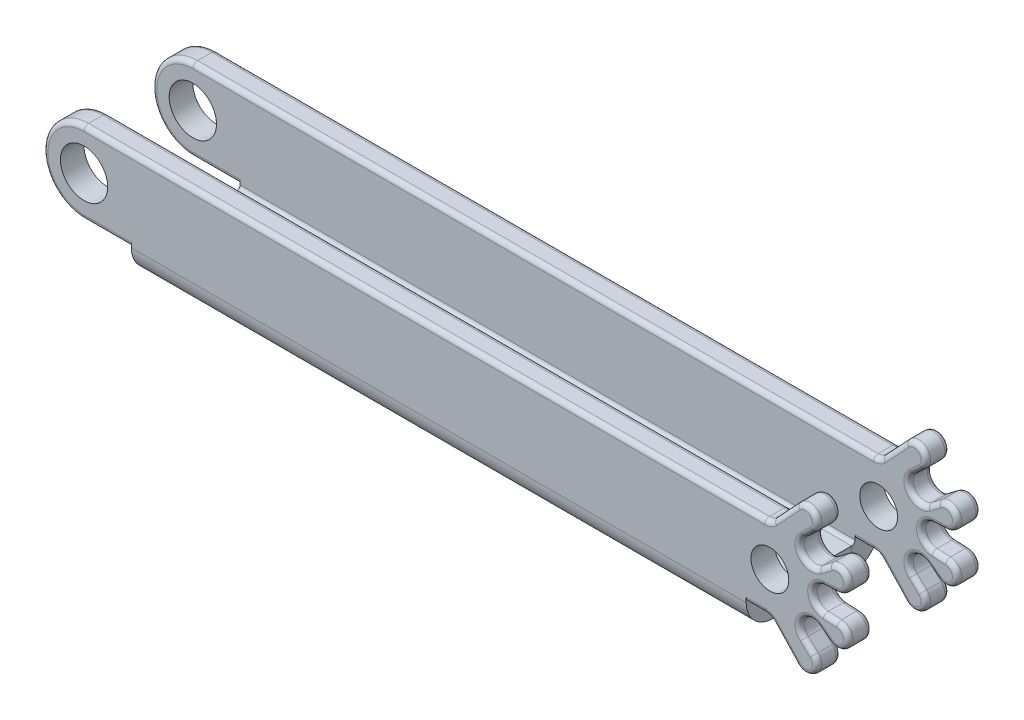
from build123d import *

# Parameters (mm, degrees)
SKETCH1_W                      = 130
SKETCH1_H                      = 28
BASE_FLANGE1_DEPTH             = 5
EDGE_FLANGE1_STRIP_W           = 21.4732
EDGE_FLANGE1_STRIP_H           = 5
EDGE_FLANGE1_STRIP_CUT_DEPTH   = 130
EDGE_FLANGE1_STRIP_2_W         = 21.4732
EDGE_FLANGE1_STRIP_2_H         = 5
EDGE_FLANGE1_STRIP_CUT_2_DEPTH = 130
EDGE_FLANGE1_DEPTH             = 130
EDGE_FLANGE1_BEND_DEPTH        = 130
SKETCH15_R                     = 5
BOSS_EXTRUDE1_DEPTH            = 5
BOSS_EXTRUDE2_DEPTH            = 5
SKETCH17_R                     = 4
CUT_EXTRUDE2_DEPTH             = 5
FILLET3_R                      = 2.5
FILLET4_R                      = 1


# Sheet-metal steps are written as plain solids
with BuildPart() as part:
    # Sketch1 → Base-Flange1 (new body)
    with BuildSketch(Plane(origin=(0, 0, 0), x_dir=(1, 0, 0), z_dir=(0, 1, 0))):
        Rectangle(SKETCH1_W, SKETCH1_H)
    extrude(amount=-BASE_FLANGE1_DEPTH)

    # Edge-Flange1 strip (across the edge) → Edge-Flange1 strip cut (cut)
    with BuildSketch(Plane(origin=(-65, 0, 14), x_dir=(0, 0, -1), z_dir=(1, 0, 0))):
        with Locations((-5, -2.5)):
            Rectangle(EDGE_FLANGE1_STRIP_W, EDGE_FLANGE1_STRIP_H)
    extrude(amount=EDGE_FLANGE1_STRIP_CUT_DEPTH, mode=Mode.SUBTRACT)

    # Edge-Flange1 strip 2 (across the edge) → Edge-Flange1 strip cut 2 (cut)
    with BuildSketch(Plane(origin=(65, 0, -14), x_dir=(0, 0, 1), z_dir=(-1, 0, 0))):
        with Locations((-5, -2.5)):
            Rectangle(EDGE_FLANGE1_STRIP_2_W, EDGE_FLANGE1_STRIP_2_H)
    extrude(amount=EDGE_FLANGE1_STRIP_CUT_2_DEPTH, mode=Mode.SUBTRACT)

    # Edge-Flange1 section (across the edge) → Edge-Flange1 (add)
    with BuildSketch(Plane(origin=(-65, 0, 14), x_dir=(0, 0, -1), z_dir=(1, 0, 0))):
        with BuildLine():
            Line((0, 0.7366), (0, 18))
            Line((0, 18), (5, 18))
            Line((5, 18), (5, 0.7366))
            ThreePointArc((5, 0.7366), (5.215745145, 0.215745145), (5.7366, 0))
            Line((5.7366, 0), (5.7366, -5))
            ThreePointArc((5.7366, -5), (1.680211239, -3.319788761), (0, 0.7366))
        make_face()
    extrude(amount=EDGE_FLANGE1_DEPTH)

    # Edge-Flange1 section 2 (across the edge) → Edge-Flange1 bend (add)
    with BuildSketch(Plane(origin=(65, 0, -14), x_dir=(0, 0, 1), z_dir=(-1, 0, 0))):
        with BuildLine():
            Line((0, 0.7366), (0, 18))
            Line((0, 18), (5, 18))
            Line((5, 18), (5, 0.7366))
            ThreePointArc((5, 0.7366), (5.215745145, 0.215745145), (5.7366, 0))
            Line((5.7366, 0), (5.7366, -5))
            ThreePointArc((5.7366, -5), (1.680211239, -3.319788761), (0, 0.7366))
        make_face()
    extrude(amount=EDGE_FLANGE1_BEND_DEPTH)

    # Sketch15 → Boss-Extrude1 (add)
    with BuildSketch(Plane.XY.offset(14)):
        with BuildLine():
            Line((-75, 18), (-65, 18))
            Line((-65, 18), (-65, 0.7366))
            Line((-65, 0.7366), (-75, 0.7366))
            ThreePointArc((-75, 0.7366), (-83.6317, 9.3683), (-75, 18))
        make_face()
        with Locations((-75, 9.3683)):
            Circle(SKETCH15_R, mode=Mode.SUBTRACT)
    boss_extrude1 = extrude(amount=-BOSS_EXTRUDE1_DEPTH)

    # Mirror3: Boss-Extrude1 across plane
    add(boss_extrude1.mirror(Plane.XY))

    # Sketch16 → Boss-Extrude2 (add)
    with BuildSketch(Plane.XY.offset(14)):
        with BuildLine():
            Line((65, 18), (70, 18))
            Line((70, 18), (75.674192261, 24.066435752))
            ThreePointArc((75.674192261, 24.066435752), (79.272990308, 24.121209175), (79.196919142, 20.52279832))
            Line((79.196919142, 20.52279832), (77.112591954, 18.596240249))
            ThreePointArc((77.112591954, 18.596240249), (76.894399988, 15.153388487), (80.322835732, 14.770420692))
            Line((80.322835732, 14.770420692), (82.582064675, 16.488538969))
            ThreePointArc((82.582064675, 16.488538969), (86.444620864, 15.353652508), (84.215222115, 12.001475782))
            Line((84.215222115, 12.001475782), (81.380167197, 11.865426368))
            ThreePointArc((81.380167197, 11.865426368), (79, 9.3683), (81.380167197, 6.871173632))
            Line((81.380167197, 6.871173632), (84.215222115, 6.735124218))
            ThreePointArc((84.215222115, 6.735124218), (86.444620864, 3.382947492), (82.582064675, 2.248061031))
            Line((82.582064675, 2.248061031), (80.322835732, 3.966179308))
            ThreePointArc((80.322835732, 3.966179308), (76.894399988, 3.583211513), (77.112591954, 0.140359751))
            Line((77.112591954, 0.140359751), (79.196919142, -1.78619832))
            ThreePointArc((79.196919142, -1.78619832), (79.272990308, -5.384609175), (75.674192261, -5.329835752))
            Line((75.674192261, -5.329835752), (70, 0.7366))
            Line((70, 0.7366), (65, 0.7366))
            Line((65, 0.7366), (65, 18))
        make_face()
    boss_extrude2 = extrude(amount=-BOSS_EXTRUDE2_DEPTH)

    # Sketch17 → Cut-Extrude2 (cut)
    with BuildSketch(Plane.XY.offset(14)):
        with Locations((70, 9.3683)):
            Circle(SKETCH17_R)
    cut_extrude2 = extrude(amount=-CUT_EXTRUDE2_DEPTH, mode=Mode.SUBTRACT)

    # Mirror5: Boss-Extrude2, Cut-Extrude2 across plane
    add(boss_extrude2.mirror(Plane.XY))
    add(cut_extrude2.mirror(Plane.XY), mode=Mode.SUBTRACT)

    # Fillet3
    fillet3_edges = [part.edges().sort_by_distance(p)[0] for p in [
        (70, 0.7366, 11.5),
        (70, 18, 11.5),
        (70, 0.7366, -11.5),
        (70, 18, -11.5),
    ]]
    fillet(fillet3_edges, radius=FILLET3_R)

    # Fillet4
    fillet4_edges = [part.edges().sort_by_distance(p)[0] for p in [
        (66.957606292, 0.7366, 9),
        (73.207606292, 21.429340528, 9),
        (79.272990308, 24.121209175, 9),
        (78.154755548, 19.559519284, 9),
        (76.894399988, 15.153388487, 9),
        (81.452450204, 15.629479831, 9),
        (86.444620864, 15.353652508, 9),
        (82.797694656, 11.933451075, 9),
        (79, 9.3683, 9),
        (82.797694656, 6.803148925, 9),
        (86.444620864, 3.382947492, 9),
        (81.452450204, 3.107120169, 9),
        (76.894399988, 3.583211513, 9),
        (78.154755548, -0.822919284, 9),
        (79.272990308, -5.384609175, 9),
        (79.272990308, -5.384609175, 14),
        (78.154755548, -0.822919284, 14),
        (76.894399988, 3.583211513, 14),
        (81.452450204, 3.107120169, 14),
        (86.444620864, 3.382947492, 14),
        (82.797694656, 6.803148925, 14),
        (79, 9.3683, 14),
        (82.797694656, 11.933451075, 14),
        (86.444620864, 15.353652508, 14),
        (81.452450204, 15.629479831, 14),
        (76.894399988, 15.153388487, 14),
        (78.154755548, 19.559519284, 14),
        (79.272990308, 24.121209175, 14),
        (73.207606292, 21.429340528, 14),
        (66.957606292, 0.7366, 14),
        (79.272990308, -5.384609175, -14),
        (78.154755548, -0.822919284, -14),
        (76.894399988, 3.583211513, -14),
        (81.452450204, 3.107120169, -14),
        (86.444620864, 3.382947492, -14),
        (82.797694656, 6.803148925, -14),
        (79, 9.3683, -14),
        (82.797694656, 11.933451075, -14),
        (86.444620864, 15.353652508, -14),
        (81.452450204, 15.629479831, -14),
        (76.894399988, 15.153388487, -14),
        (78.154755548, 19.559519284, -14),
        (79.272990308, 24.121209175, -14),
        (73.207606292, 21.429340528, -14),
        (66.957606292, 0.7366, -14),
        (79.272990308, -5.384609175, -9),
        (78.154755548, -0.822919284, -9),
        (76.894399988, 3.583211513, -9),
        (81.452450204, 3.107120169, -9),
        (86.444620864, 3.382947492, -9),
        (82.797694656, 6.803148925, -9),
        (79, 9.3683, -9),
        (82.797694656, 11.933451075, -9),
        (86.444620864, 15.353652508, -9),
        (81.452450204, 15.629479831, -9),
        (76.894399988, 15.153388487, -9),
        (78.154755548, 19.559519284, -9),
        (79.272990308, 24.121209175, -9),
        (73.207606292, 21.429340528, -9),
        (66.957606292, 0.7366, -9),
        (-3.042393708, 18, 9),
        (-3.042393708, 18, 14),
        (73.207606292, -2.692740528, 14),
        (73.207606292, -2.692740528, 9),
        (73.207606292, -2.692740528, -14),
        (73.207606292, -2.692740528, -9),
        (69.910354096, 18.206597861, 14),
        (69.910354096, 18.206597861, 9),
        (69.910354096, 0.530002139, 14),
        (69.910354096, 0.530002139, 9),
        (69.910354096, 0.530002139, -14),
        (69.910354096, 0.530002139, -9),
        (69.910354096, 18.206597861, -14),
        (69.910354096, 18.206597861, -9),
        (-3.042393708, 18, -14),
        (-3.042393708, 18, -9),
        (-70, 0.7366, 9),
        (-83.6317, 9.3683, 9),
        (-70, 0.7366, 14),
        (-83.6317, 9.3683, 14),
        (-70, 0.7366, -9),
        (-83.6317, 9.3683, -9),
        (-70, 0.7366, -14),
        (-83.6317, 9.3683, -14),
    ]]
    fillet(fillet4_edges, radius=FILLET4_R)


solid = part.part
